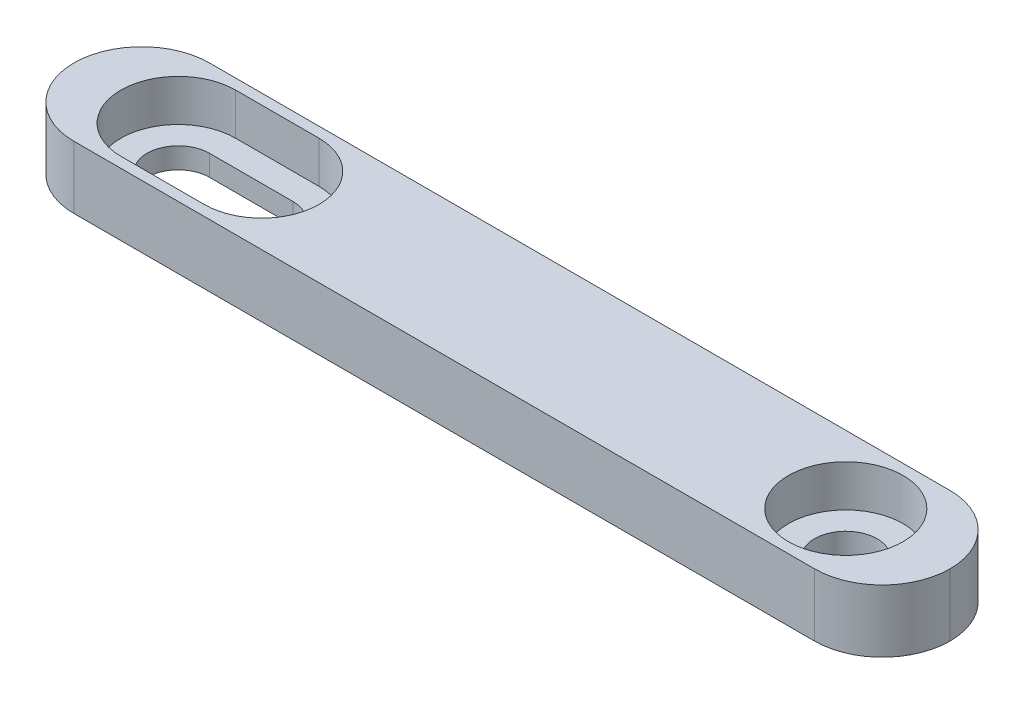
from build123d import *

# Parameters (mm, degrees)
ESBO_O1_W                = 42
ESBO_O1_H                = 6.5
RESSALTO_EXTRUS_O1_DEPTH = 3
ESBO_O2_R                = 1.5
CORTE_EXTRUS_O1_DEPTH    = 22.460719932
ESBO_O3_R                = 2.75
CORTE_EXTRUS_O2_DEPTH    = 2
FILETE1_R                = 3.25


with BuildPart() as part:
    # Esboço1 → Ressalto-extrusão1 (new body)
    with BuildSketch(Plane(origin=(0, 0, 0), x_dir=(1, 0, 0), z_dir=(0, 1, 0))):
        Rectangle(ESBO_O1_W, ESBO_O1_H)
    extrude(amount=RESSALTO_EXTRUS_O1_DEPTH)

    # Esboço2 → Corte-extrusão1 (cut, through all)
    with BuildSketch(Plane(origin=(0, 3, 0), x_dir=(1, 0, 0), z_dir=(0, 1, 0))):
        with Locations(Location((16, 0, 0), (0, 0, 270))):
            Circle(ESBO_O2_R)
        with BuildLine():
            Line((-16, 1.5), (-12, 1.5))
            ThreePointArc((-12, 1.5), (-10.5, 0), (-12, -1.5))
            Line((-12, -1.5), (-16, -1.5))
            ThreePointArc((-16, -1.5), (-17.5, 0), (-16, 1.5))
        make_face()
    extrude(amount=-CORTE_EXTRUS_O1_DEPTH, mode=Mode.SUBTRACT)

    # Esboço3 → Corte-extrusão2 (cut)
    with BuildSketch(Plane(origin=(0, 3, 0), x_dir=(1, 0, 0), z_dir=(0, 1, 0))):
        with Locations(Location((16, 0, 0), (0, 0, 270))):
            Circle(ESBO_O3_R)
        with BuildLine():
            Line((-16, 2.75), (-12, 2.75))
            ThreePointArc((-12, 2.75), (-9.25, 0), (-12, -2.75))
            Line((-12, -2.75), (-16, -2.75))
            ThreePointArc((-16, -2.75), (-18.75, 0), (-16, 2.75))
        make_face()
    extrude(amount=-CORTE_EXTRUS_O2_DEPTH, mode=Mode.SUBTRACT)

    # Filete1
    filete1_edges = [part.edges().sort_by_distance(p)[0] for p in [
        (21, 1.5, 3.25),
        (21, 1.5, -3.25),
        (-21, 1.5, 3.25),
        (-21, 1.5, -3.25),
    ]]
    fillet(filete1_edges, radius=FILETE1_R - 0.0001)  # a hair under: the kernel refuses the full size


solid = part.part
